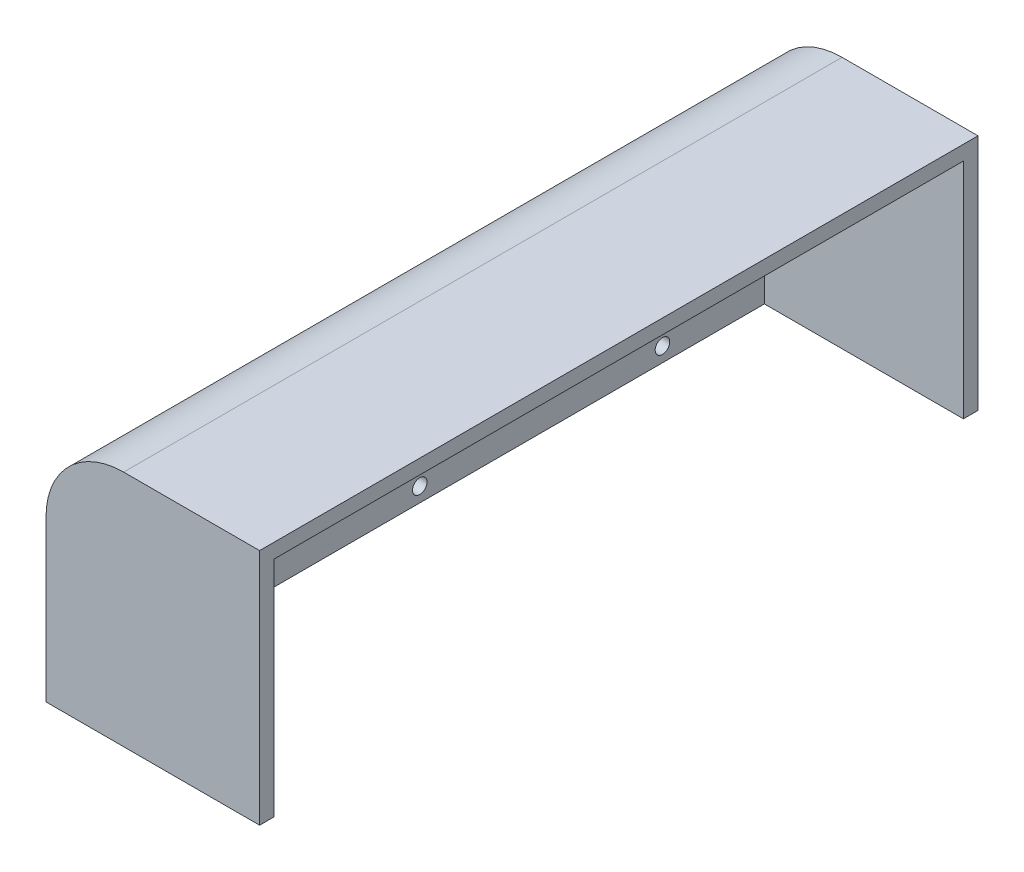
from build123d import *

# Parameters (mm, degrees)
BOSS_EXTRUDE1_DEPTH     = 23
SKETCH3_W               = 22
SKETCH3_H               = 74
BOSS_EXTRUDE2_DEPTH     = 1.5
FILLET1_R               = 8
CUT_EXTRUDE1_DEPTH      = 50.53029376
CUT_EXTRUDE1_DEPTH_BACK = 50.53029376
SKETCH4_R               = 0.75


with BuildPart() as part:
    # Sketch2 → Boss-Extrude1 (new body)
    with BuildSketch(Plane(origin=(0, 0, 0), x_dir=(1, 0, 0), z_dir=(0, 1, 0))):
        Polygon((-10.5, -35.5), (10, -35.5), (10, -37), (-12, -37), (-12, 37), (10, 37), (10, 35.5), (-10.5, 35.5), align=None)
    extrude(amount=BOSS_EXTRUDE1_DEPTH)

    # Sketch3 → Boss-Extrude2 (add)
    with BuildSketch(Plane(origin=(0, 23, 0), x_dir=(1, 0, 0), z_dir=(0, 1, 0))):
        with Locations((-1, 0)):
            Rectangle(SKETCH3_W, SKETCH3_H)
    extrude(amount=BOSS_EXTRUDE2_DEPTH)

    # Fillet1
    fillet1_edges = [part.edges().sort_by_distance(p)[0] for p in [
        (-10.5, 23, 0),
        (-12, 24.5, 0),
    ]]
    fillet(fillet1_edges, radius=FILLET1_R)

    # Sketch4 → Cut-Extrude1 (cut, two sides: drawn at the far end of the back side and taken through both)
    with BuildSketch(Plane.ZY.offset(12).offset(-CUT_EXTRUDE1_DEPTH_BACK)):
        with Locations((-25, 1.5)):
            Circle(SKETCH4_R)
        with Locations((0, 1.5)):
            Circle(SKETCH4_R)
        with Locations((25, 1.5)):
            Circle(SKETCH4_R)
    extrude(amount=CUT_EXTRUDE1_DEPTH + CUT_EXTRUDE1_DEPTH_BACK, mode=Mode.SUBTRACT)


solid = part.part
